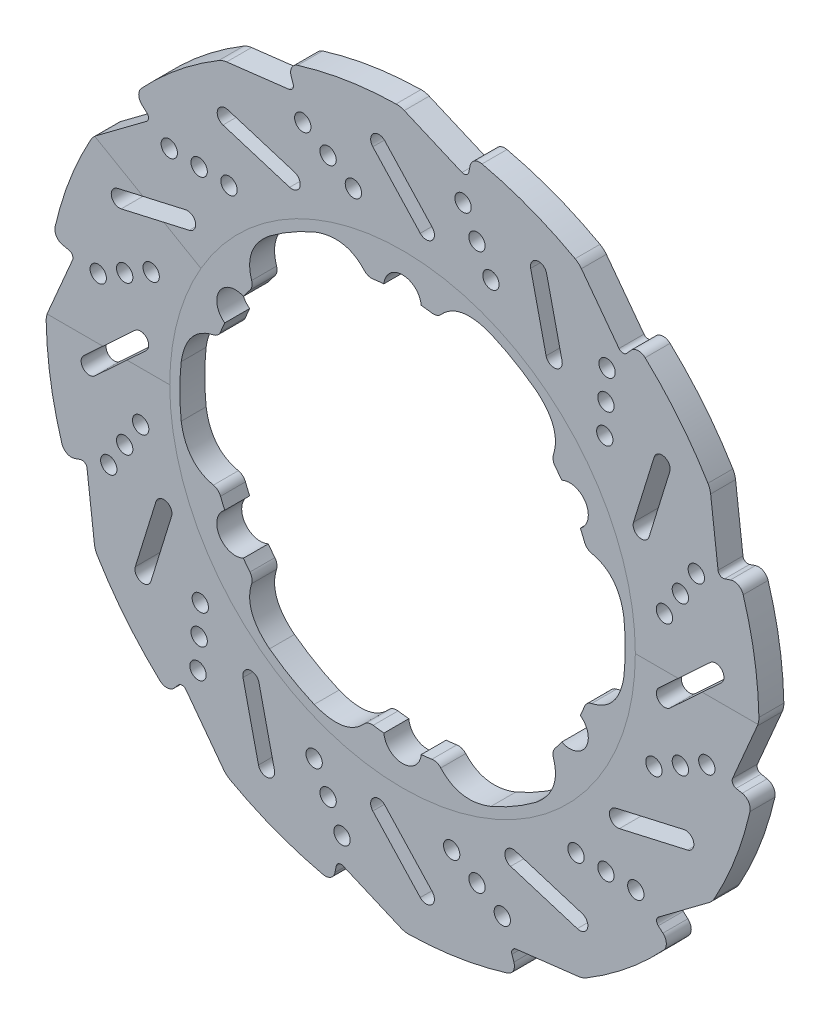
from build123d import *

# Parameters (mm, degrees)
SKETCH1_R               = 90.805
SKETCH1_R_2             = 56.769
ROTORBODY_DEPTH         = 6.35
FLOATPINIF_DEPTH        = 6.35
FLOATPINPATTERN_COUNT   = 6
SKETCH3_R               = 2.0828
SLOT_HOLES_DEPTH        = 129.57456431
SLOT_HOLESPATTERN_COUNT = 12
PERIMETERCUTOUT_DEPTH   = 129.57456431
PERIMETERPATTERN_COUNT  = 12
PERIMETERFILLET_DEPTH   = 129.572242012
PFILLETPATTERN_COUNT    = 12
FLOATPINIFFILLETS_R     = 2.54


with BuildPart() as part:
    # Sketch1 → RotorBody (new body)
    with BuildSketch(Plane.XY):
        Circle(SKETCH1_R)
        Circle(SKETCH1_R_2, mode=Mode.SUBTRACT)
    extrude(amount=ROTORBODY_DEPTH)

    # Sketch2 → FloatPinIF (add, through all)
    with BuildSketch(Plane.XY.offset(6.35)):
        with BuildLine():
            ThreePointArc((-4.744960244, 49.557360788), (0, 53.9115), (4.744960244, 49.557360788))
            ThreePointArc((4.744960244, 49.557360788), (6.823508824, 49.314160069), (8.89, 48.983819328))
            add(Edge.make_bspline(
                [(8.89, 48.983819328), (13.794843896, 55.517257255), (22.503435647, 52.118276498)],
                knots=[0, 0, 0, 0.861573233, 0.861573233, 0.861573233], degree=2))
            ThreePointArc((22.503435647, 52.118276498), (0, 56.769), (-22.503435647, 52.118276498))
            add(Edge.make_bspline(
                [(-8.89, 48.983819328), (-13.794843896, 55.517257255), (-22.503435647, 52.118276498)],
                knots=[0, 0, 0, 0.861573233, 0.861573233, 0.861573233], degree=2))
            ThreePointArc((-8.89, 48.983819328), (-6.823508824, 49.314160069), (-4.744960244, 49.557360788))
        make_face()
    floatpinif = extrude(amount=-FLOATPINIF_DEPTH)

    # FloatPinPattern: FloatPinIF ×6 about axis
    floatpinpattern_axis = Axis((0, 0, 6.35), (0, 0, -1))
    for i in range(1, FLOATPINPATTERN_COUNT):
        add(floatpinif.rotate(floatpinpattern_axis, i * 360 / FLOATPINPATTERN_COUNT))

    # Sketch3 → Slot+Holes (cut, through all)
    with BuildSketch(Plane.XY.offset(6.35)):
        with Locations((15.411229321, 77.522108275)):
            Circle(SKETCH3_R)
        with Locations((18.966000806, 70.782078625)):
            Circle(SKETCH3_R)
        with Locations((22.520772291, 64.042048974)):
            Circle(SKETCH3_R)
        with BuildLine():
            Line((-7.569131706, 78.385701582), (4.513086746, 65.341607237))
            ThreePointArc((4.513086746, 65.341607237), (7.456454816, 65.228930347), (7.569131706, 68.172298418))
            Line((7.569131706, 68.172298418), (-4.513086746, 81.216392763))
            ThreePointArc((-4.513086746, 81.216392763), (-7.456454816, 81.329069653), (-7.569131706, 78.385701582))
        make_face()
    slot_holes = extrude(amount=-SLOT_HOLES_DEPTH, mode=Mode.SUBTRACT)

    # Slot+HolesPattern: Slot+Holes ×12 about axis
    slot_holespattern_axis = Axis((0, 0, 0), (0, 0, 1))
    for i in range(1, SLOT_HOLESPATTERN_COUNT):
        add(slot_holes.rotate(slot_holespattern_axis, i * 360 / SLOT_HOLESPATTERN_COUNT), mode=Mode.SUBTRACT)

    # Sketch5 → PerimeterCutOut (cut, through all)
    with BuildSketch(Plane.XY.offset(6.35)):
        with BuildLine():
            ThreePointArc((15.14781429, 84.074959048), (16.240081321, 84.118548341), (16.893868482, 84.994624617))
            Line((16.893868482, 84.994624617), (17.200162275, 86.535617192))
            Line((17.200162275, 86.535617192), (17.702462324, 89.062735488))
            ThreePointArc((17.702462324, 89.062735488), (8.622053171, 90.3947356), (-0.546430028, 90.803355881))
            Line((-0.546430028, 90.803355881), (0.441504429, 90.379811113))
            Line((0.441504429, 90.379811113), (15.14781429, 84.074959048))
        make_face()
    perimetercutout = extrude(amount=-PERIMETERCUTOUT_DEPTH, mode=Mode.SUBTRACT)

    # PerimeterPattern: PerimeterCutOut ×12 about axis
    perimeterpattern_axis = Axis((0, 0, 0), (0, 0, 1))
    for i in range(1, PERIMETERPATTERN_COUNT):
        add(perimetercutout.rotate(perimeterpattern_axis, i * 360 / PERIMETERPATTERN_COUNT), mode=Mode.SUBTRACT)

    # Sketch5<5> → PerimeterFillet (cut, through all)
    with BuildSketch(Plane.XY.offset(6.35)):
        with BuildLine():
            Line((17.702462324, 89.062735488), (17.200162275, 86.535617192))
            ThreePointArc((17.200162275, 86.535617192), (18.31051164, 88.172266843), (20.25808739, 88.516427404))
            ThreePointArc((20.25808739, 88.516427404), (18.982240299, 88.79877577), (17.702462324, 89.062735488))
        make_face()
        with BuildLine():
            ThreePointArc((-0.546430028, 90.803355881), (-1.099553862, 90.798342531), (-1.652636894, 90.789959887))
            ThreePointArc((-1.652636894, 90.789959887), (-0.583787212, 90.696085019), (0.441504429, 90.379811113))
            Line((0.441504429, 90.379811113), (-0.546430028, 90.803355881))
        make_face()
    perimeterfillet = extrude(amount=-PERIMETERFILLET_DEPTH, mode=Mode.SUBTRACT)

    # PFilletPattern: PerimeterFillet ×12 about axis
    pfilletpattern_axis = Axis((0, 0, 0), (0, 0, 1))
    for i in range(1, PFILLETPATTERN_COUNT):
        add(perimeterfillet.rotate(pfilletpattern_axis, i * 360 / PFILLETPATTERN_COUNT), mode=Mode.SUBTRACT)

    # FloatPinIFFillets
    floatpiniffillets_edges = [part.edges().sort_by_distance(p)[0] for p in [
        (37.976231913, 32.190875504, 3.175),
        (46.866231913, 16.792943825, 3.175),
        (46.866231913, -16.792943825, 3.175),
        (37.976231913, -32.190875504, 3.175),
        (8.89, -48.983819328, 3.175),
        (-8.89, -48.983819328, 3.175),
        (-37.976231913, -32.190875504, 3.175),
        (-46.866231913, -16.792943825, 3.175),
        (-46.866231913, 16.792943825, 3.175),
        (-37.976231913, 32.190875504, 3.175),
        (8.89, 48.983819328, 3.175),
        (-8.89, 48.983819328, 3.175),
    ]]
    fillet(floatpiniffillets_edges, radius=FLOATPINIFFILLETS_R)


solid = part.part
